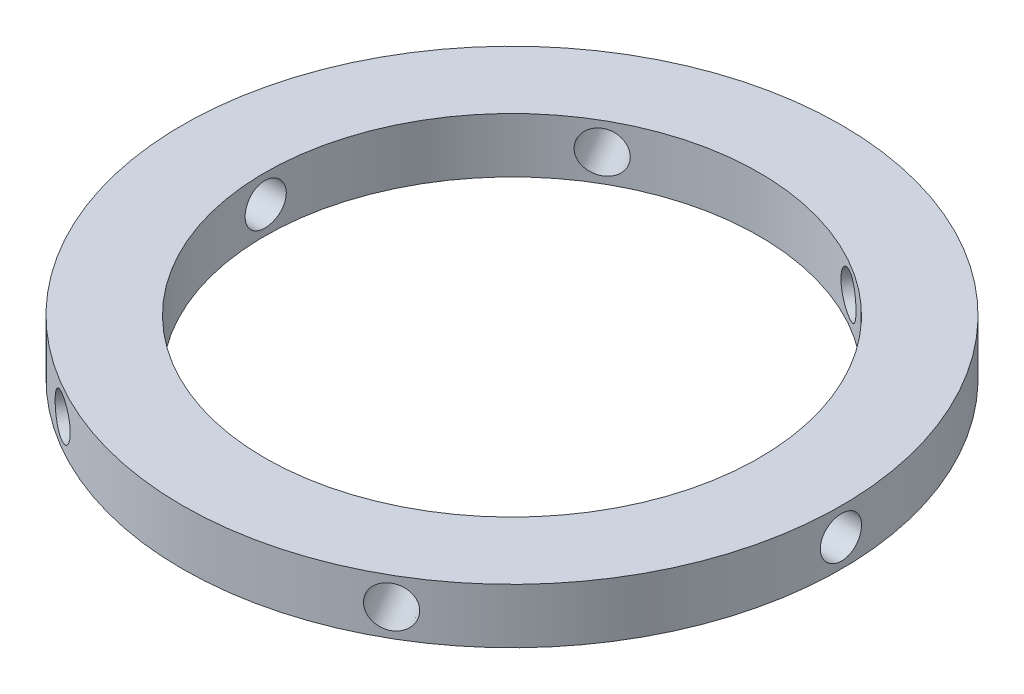
from build123d import *

# Parameters (mm, degrees)
SKETCH1_R           = 76.2
SKETCH1_R_2         = 57.15
BOSS_EXTRUDE1_DEPTH = 6.35
SCALE1_SCALE_X      = 0.5
SCALE1_SCALE_Y      = 1
SCALE1_SCALE_Z      = 0.5
CUT_EXTRUDE1_START  = 28.475608294
CUT_EXTRUDE1_DEPTH  = 9.624391803
CIRPATTERN1_COUNT   = 6


# Read off the part's stored shape, not the designer's step: Cut-Extrude1
with BuildPart() as part:
    # Sketch1 → Boss-Extrude1 (new body)
    with BuildSketch(Plane(origin=(0, 0, -13.767833252), x_dir=(1, 0, 0), z_dir=(0, 1, 0))):
        with Locations(Location((0, -13.767833252, 0), (0, 0, 270))):
            Circle(SKETCH1_R)
        with Locations(Location((0, -13.767833252, 0), (0, 0, 270))):
            Circle(SKETCH1_R_2, mode=Mode.SUBTRACT)
    extrude(amount=BOSS_EXTRUDE1_DEPTH)


with BuildPart() as part_1:
    # Scale1: scaled about (0, 3.175, 0)
    add(part.part.scale((SCALE1_SCALE_X, SCALE1_SCALE_Y, SCALE1_SCALE_Z), about=(0, 3.175, 0)))

    # Cut-Extrude1 outline → Cut-Extrude1 (cut)
    with BuildSketch(Plane(origin=(0, 0, 0), x_dir=(0, 0, -1), z_dir=(1, 0, 0)).offset(CUT_EXTRUDE1_START)):
        with BuildLine():
            add(Edge.make_bspline(
                [(-2.38125, 3.175), (-2.38125, 2.545568141), (-2.12293522, 1.93025639), (-1.244343415, 1.051830184), (-0.622624602, 0.794084026), (0.620066989, 0.793416661), (1.238205437, 1.046038641), (2.127765913, 1.934741402), (2.38102668, 2.552475789), (2.381473013, 3.795814572), (2.124087634, 4.417656617), (1.246767227, 5.296677456), (0.630892945, 5.55562297), (-0.626150694, 5.556874669), (-1.242634681, 5.299262197), (-2.122285602, 4.421007486), (-2.38125, 3.804431859), (-2.38125, 3.175)],
                knots=[0, 0, 0, 0, 0.125, 0.125, 0.25, 0.25, 0.375, 0.375, 0.5, 0.5, 0.625, 0.625, 0.75, 0.75, 0.875, 0.875, 1, 1, 1, 1], degree=3))
        make_face()
    cut_extrude1 = extrude(amount=CUT_EXTRUDE1_DEPTH, mode=Mode.SUBTRACT)

    # CirPattern1: Cut-Extrude1 ×6 about axis
    cirpattern1_axis = Axis((0, 6.35, 0), (0, 1, 0))
    for i in range(1, CIRPATTERN1_COUNT):
        add(cut_extrude1.rotate(cirpattern1_axis, i * 360 / CIRPATTERN1_COUNT), mode=Mode.SUBTRACT)


solid = part_1.part
